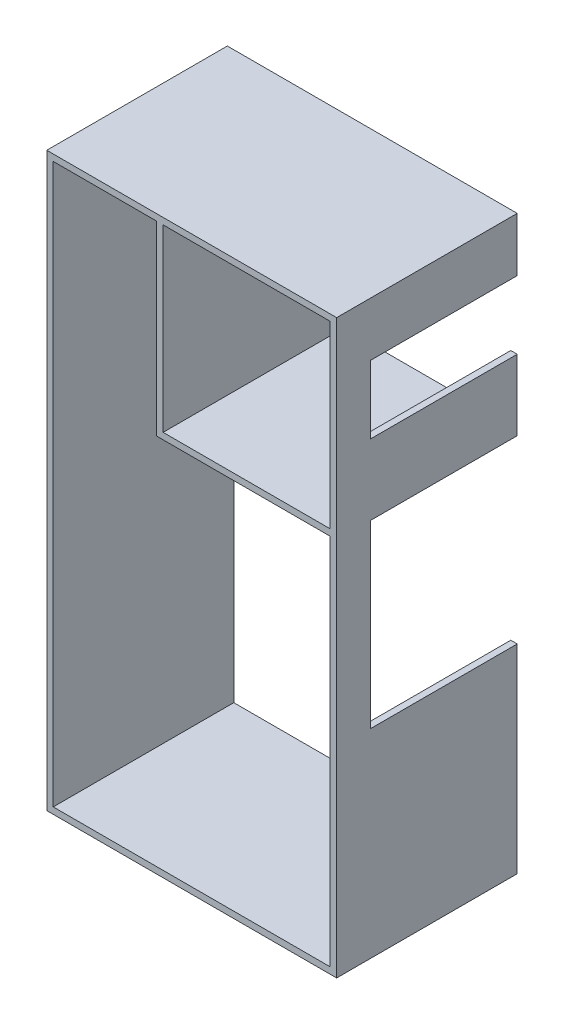
from build123d import *

# Parameters (mm, degrees)
EXTRUDE_THIN1_OUTLINE_W   = 4495.215169973
EXTRUDE_THIN1_OUTLINE_H   = 8868.918797099
EXTRUDE_THIN1_OUTLINE_W_2 = 4295.215169973
EXTRUDE_THIN1_OUTLINE_H_2 = 8668.918797099
EXTRUDE_THIN1_DEPTH       = 2800
SKETCH2_W                 = 2278.564495204
SKETCH2_H                 = 3084.203300048
SKETCH2_H_2               = 1183.861490667
CUT_EXTRUDE1_DEPTH        = 270
SKETCH3_W                 = 2791.287447335
SKETCH3_H                 = 2986.727723293
SKETCH3_W_2               = 2591.287447335
SKETCH3_H_2               = 2786.727723293
EXTRUDE_THIN2_DEPTH       = 2800
SKETCH4_W                 = 2278.564495204
SKETCH4_H                 = 1054.990856004
CUT_EXTRUDE2_DEPTH        = 140


# Read off the part's stored shape, not the designer's step: Extrude-Thin1
with BuildPart() as part:
    # Extrude-Thin1 outline → Extrude-Thin1 (new body)
    with BuildSketch(Plane.XY.offset(38871.700196057)):
        with Locations((-31804.010098304, 8633.021968037)):
            Rectangle(EXTRUDE_THIN1_OUTLINE_W, EXTRUDE_THIN1_OUTLINE_H)
        with Locations((-31804.010098304, 8633.021968037)):
            Rectangle(EXTRUDE_THIN1_OUTLINE_W_2, EXTRUDE_THIN1_OUTLINE_H_2, mode=Mode.SUBTRACT)
    extrude(amount=EXTRUDE_THIN1_DEPTH)

    # Sketch2 → Cut-Extrude1 (cut)
    with BuildSketch(Plane(origin=(-29556.402513318, 0, 0), x_dir=(0, 0, -1), z_dir=(1, 0, 0))):
        with Locations((-40010.982443659, 8827.108478048)):
            Rectangle(SKETCH2_W, SKETCH2_H)
        with Locations((-40010.982443659, 11948.084927174)):
            Rectangle(SKETCH2_W, SKETCH2_H_2)
    extrude(amount=-CUT_EXTRUDE1_DEPTH, mode=Mode.SUBTRACT)

    # Sketch3 → Extrude-Thin2 (add)
    with BuildSketch(Plane.XY.offset(38871.700196057)):
        with Locations((-30952.046236986, 11574.11750494)):
            Rectangle(SKETCH3_W, SKETCH3_H)
        with Locations((-30952.046236986, 11574.11750494)):
            Rectangle(SKETCH3_W_2, SKETCH3_H_2, mode=Mode.SUBTRACT)
    extrude(amount=EXTRUDE_THIN2_DEPTH)

    # Sketch4 → Cut-Extrude2 (cut)
    with BuildSketch(Plane(origin=(-29556.402513318, 0, 0), x_dir=(0, 0, -1), z_dir=(1, 0, 0))):
        with Locations((-40010.982443659, 11703.351961029)):
            Rectangle(SKETCH4_W, SKETCH4_H)
    extrude(amount=-CUT_EXTRUDE2_DEPTH, mode=Mode.SUBTRACT)


solid = part.part
